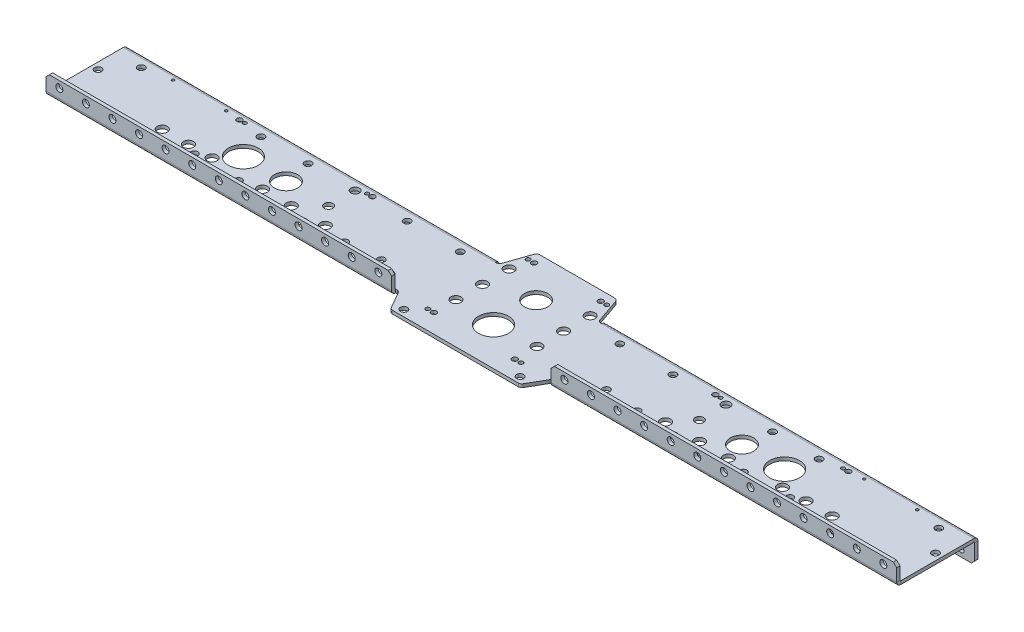
from build123d import *

# Parameters (mm, degrees)
SKETCH1_W                              = 812.8
SKETCH1_H                              = 69.85
BOSS_EXTRUDE1_DEPTH                    = 3.175
SKETCH3_R                              = 14.2875
CUT_EXTRUDE1_DEPTH                     = 816.802024467
EDGE_FLANGE1_DEPTH                     = 812.8
EDGE_FLANGE2_DEPTH                     = 812.8
SKETCH10_R                             = 4.826
LONG_6WD_DEPTH                         = 817.444922817
SKETCH11_R                             = 4.826
SHORT_6WD_DEPTH                        = 817.444922817
SKETCH12_R                             = 3.3528
F_8WD_EGG_DEPTH                        = 817.444922817
SKETCH13_R                             = 3.3528
LOWER_CHURRO_DEPTH                     = 817.444922817
SKETCH14_R                             = 2.667
UPPER_FLANGE_HP_DEPTH                  = 817.729920277
SKETCH16_R                             = 3.3528
LOWER_FLANGE_HP_DEPTH                  = 817.433889486
LPATTERN1_COUNT                        = 32
LPATTERN1_PITCH                        = 25.4
SKETCH17_W                             = 152.4
SKETCH17_H                             = 6.35
CUT_EXTRUDE9_DEPTH                     = 818.031193633
SKETCH18_W                             = 146.05
SKETCH18_H                             = 3.175
BOSS_EXTRUDE2_DEPTH                    = 19.05
SKETCH19_W                             = 101.6
SKETCH19_H                             = 3.937
CUT_EXTRUDE10_DEPTH                    = 818.031193633
SKETCH20_W                             = 95.25
SKETCH20_H                             = 3.175
BOSS_EXTRUDE3_DEPTH                    = 27.432
CUT_EXTRUDE14_DEPTH                    = 819.902667079
SKETCH21_R                             = 11.1125
SKETCH21_R_2                           = 4.7625
SKETCH21_R_3                           = 2.54
SKETCH21_R_4                           = 2.032
TB_MINI_SHAFT_PLATE_DEPTH              = 819.8226487
CUT_EXTRUDE12_DEPTH                    = 819.8226487
SKETCH23_R                             = 3.3528
UPPER_INTERNAL_CHIRRO_HP_DEPTH         = 819.8226487
SKETCH24_R                             = 1.27
CUTTING_GUIDES_DEPTH                   = 819.8226487
SKETCH26_R                             = 3.4036
SONIC_MOUNTING_HOLES_DEPTH             = 819.902667079
SKETCH29_R                             = 2.5527
SKETCH29_R_2                           = 1.7859375
SKETCH29_R_3                           = 14.2875
SKETCH29_R_4                           = 11.1125
SKETCH29_R_5                           = 4.064
TB_MICRO_MOUNTING_DEPTH                = 819.902667079
FILLET1_R                              = 3.175
CHAMFER1_SIZE                          = 3.175
SKETCH30_R                             = 3.3528
BOTTOM_CORNER_SUPPORT_USE_CHURRO_DEPTH = 819.902667079
SKETCH32_R                             = 3.3528
CUT_EXTRUDE15_DEPTH                    = 819.902667079
SKETCH33_R                             = 3.3528
CUT_EXTRUDE16_DEPTH                    = 819.902667079


# Sheet-metal steps are written as plain solids
with BuildPart() as part:
    # Sketch1 → Boss-Extrude1 (new body)
    with BuildSketch(Plane(origin=(0, 0, 0), x_dir=(1, 0, 0), z_dir=(0, 1, 0))):
        with Locations((406.4, 34.925)):
            Rectangle(SKETCH1_W, SKETCH1_H)
    extrude(amount=BOSS_EXTRUDE1_DEPTH)

    # Sketch3 → Cut-Extrude1 (cut, through all)
    with BuildSketch(Plane(origin=(0, 3.175, 0), x_dir=(1, 0, 0), z_dir=(0, 1, 0))):
        with Locations(Location((406.4, 17.272, 0), (0, 0, 270))):
            Circle(SKETCH3_R)
    extrude(amount=-CUT_EXTRUDE1_DEPTH, mode=Mode.SUBTRACT)

    # Edge-Flange1 section (across the edge) → Edge-Flange1 (add)
    with BuildSketch(Plane(origin=(0, 3.175, 0.762), x_dir=(0, 0, -1), z_dir=(1, 0, 0))):
        with BuildLine():
            Line((-3.175, 0.762), (-3.175, 15.875))
            Line((-3.175, 15.875), (0, 15.875))
            Line((0, 15.875), (0, 0.762))
            ThreePointArc((0, 0.762), (0.223184633, 0.223184633), (0.762, 0))
            Line((0.762, 0), (0.762, -3.175))
            ThreePointArc((0.762, -3.175), (-2.021879398, -2.021879398), (-3.175, 0.762))
        make_face()
    extrude(amount=EDGE_FLANGE1_DEPTH)

    # Edge-Flange2 section (across the edge) → Edge-Flange2 (add)
    with BuildSketch(Plane(origin=(0, 0, -70.612), x_dir=(0, 0, 1), z_dir=(1, 0, 0))):
        with BuildLine():
            Line((-3.175, 0.762), (-3.175, 19.05))
            Line((-3.175, 19.05), (0, 19.05))
            Line((0, 19.05), (0, 0.762))
            ThreePointArc((0, 0.762), (0.223184633, 0.223184633), (0.762, 0))
            Line((0.762, 0), (0.762, -3.175))
            ThreePointArc((0.762, -3.175), (-2.021879398, -2.021879398), (-3.175, 0.762))
        make_face()
    extrude(amount=EDGE_FLANGE2_DEPTH)

    # Sketch10 → Long 6wd (cut, through all)
    with BuildSketch(Plane(origin=(0, 3.175, 0), x_dir=(1, 0, 0), z_dir=(0, 1, 0))):
        with Locations(Location((86.339113657, 20.828, 0), (0, 0, 270))):
            Circle(SKETCH10_R)
        with Locations(Location((111.349627997, 20.828, 0), (0, 0, 270))):
            Circle(SKETCH10_R)
        with Locations(Location((133.855797334, 20.828, 0), (0, 0, 270))):
            Circle(SKETCH10_R)
        with Locations(Location((726.460886343, 20.828, 0), (0, 0, 270))):
            Circle(SKETCH10_R)
        with Locations(Location((701.450372003, 20.828, 0), (0, 0, 270))):
            Circle(SKETCH10_R)
        with Locations(Location((678.944202666, 20.828, 0), (0, 0, 270))):
            Circle(SKETCH10_R)
    extrude(amount=-LONG_6WD_DEPTH, mode=Mode.SUBTRACT)

    # Sketch11 → Short 6wd (cut, through all)
    with BuildSketch(Plane(origin=(0, 3.175, 0), x_dir=(1, 0, 0), z_dir=(0, 1, 0))):
        with Locations(Location((183.852302373, 19.05, 0), (0, 0, 270))):
            Circle(SKETCH11_R)
        with Locations(Location((211.361504088, 19.05, 0), (0, 0, 270))):
            Circle(SKETCH11_R)
        with Locations(Location((243.875125248, 19.05, 0), (0, 0, 270))):
            Circle(SKETCH11_R)
        with Locations(Location((568.924874752, 19.05, 0), (0, 0, 270))):
            Circle(SKETCH11_R)
        with Locations(Location((601.438495912, 19.05, 0), (0, 0, 270))):
            Circle(SKETCH11_R)
        with Locations(Location((628.947697627, 19.05, 0), (0, 0, 270))):
            Circle(SKETCH11_R)
    extrude(amount=-SHORT_6WD_DEPTH, mode=Mode.SUBTRACT)

    # Sketch12 → 8wd egg (cut, through all)
    with BuildSketch(Plane(origin=(0, 3.175, 0), x_dir=(1, 0, 0), z_dir=(0, 1, 0))):
        with Locations(Location((298.874532383, 17.547282407, 0), (0, 0, 270))):
            Circle(SKETCH12_R)
        with Locations(Location((513.925467617, 17.547282407, 0), (0, 0, 270))):
            Circle(SKETCH12_R)
    extrude(amount=-F_8WD_EGG_DEPTH, mode=Mode.SUBTRACT)

    # Sketch13 → lower churro (cut, through all)
    with BuildSketch(Plane(origin=(0, 3.175, 0), x_dir=(1, 0, 0), z_dir=(0, 1, 0))):
        with Locations(Location((165.1, 14.732, 0), (0, 0, 270))):
            Circle(SKETCH13_R)
        with Locations(Location((266.7, 14.732, 0), (0, 0, 270))):
            Circle(SKETCH13_R)
        with Locations(Location((546.1, 14.732, 0), (0, 0, 270))):
            Circle(SKETCH13_R)
        with Locations(Location((647.7, 14.732, 0), (0, 0, 270))):
            Circle(SKETCH13_R)
    extrude(amount=-LOWER_CHURRO_DEPTH, mode=Mode.SUBTRACT)

    # Sketch14 → upper flange HP (cut, through all)
    with BuildSketch(Plane(origin=(0, 0, -73.787), x_dir=(-1, 0, 0), z_dir=(0, 0, -1))):
        with Locations(Location((-12.7, -12.7, 0), (0, 0, 90))):
            Circle(SKETCH14_R)
        with Locations(Location((-38.1, -12.7, 0), (0, 0, 90))):
            Circle(SKETCH14_R)
        with Locations(Location((-63.5, -12.7, 0), (0, 0, 90))):
            Circle(SKETCH14_R)
        with Locations(Location((-88.9, -12.7, 0), (0, 0, 90))):
            Circle(SKETCH14_R)
        with Locations(Location((-114.3, -12.7, 0), (0, 0, 90))):
            Circle(SKETCH14_R)
        with Locations(Location((-139.7, -12.7, 0), (0, 0, 90))):
            Circle(SKETCH14_R)
        with Locations(Location((-165.1, -12.7, 0), (0, 0, 90))):
            Circle(SKETCH14_R)
        with Locations(Location((-190.5, -12.7, 0), (0, 0, 90))):
            Circle(SKETCH14_R)
        with Locations(Location((-215.9, -12.7, 0), (0, 0, 90))):
            Circle(SKETCH14_R)
        with Locations(Location((-241.3, -12.7, 0), (0, 0, 90))):
            Circle(SKETCH14_R)
        with Locations(Location((-266.7, -12.7, 0), (0, 0, 90))):
            Circle(SKETCH14_R)
        with Locations(Location((-292.1, -12.7, 0), (0, 0, 90))):
            Circle(SKETCH14_R)
        with Locations(Location((-317.5, -12.7, 0), (0, 0, 90))):
            Circle(SKETCH14_R)
        with Locations(Location((-342.9, -12.7, 0), (0, 0, 90))):
            Circle(SKETCH14_R)
        with Locations(Location((-368.3, -12.7, 0), (0, 0, 90))):
            Circle(SKETCH14_R)
        with Locations(Location((-393.7, -12.7, 0), (0, 0, 90))):
            Circle(SKETCH14_R)
        with Locations(Location((-419.1, -12.7, 0), (0, 0, 90))):
            Circle(SKETCH14_R)
        with Locations(Location((-444.5, -12.7, 0), (0, 0, 90))):
            Circle(SKETCH14_R)
        with Locations(Location((-469.9, -12.7, 0), (0, 0, 90))):
            Circle(SKETCH14_R)
        with Locations(Location((-495.3, -12.7, 0), (0, 0, 90))):
            Circle(SKETCH14_R)
        with Locations(Location((-520.7, -12.7, 0), (0, 0, 90))):
            Circle(SKETCH14_R)
        with Locations(Location((-546.1, -12.7, 0), (0, 0, 90))):
            Circle(SKETCH14_R)
        with Locations(Location((-571.5, -12.7, 0), (0, 0, 90))):
            Circle(SKETCH14_R)
        with Locations(Location((-596.9, -12.7, 0), (0, 0, 90))):
            Circle(SKETCH14_R)
        with Locations(Location((-622.3, -12.7, 0), (0, 0, 90))):
            Circle(SKETCH14_R)
        with Locations(Location((-647.7, -12.7, 0), (0, 0, 90))):
            Circle(SKETCH14_R)
        with Locations(Location((-673.1, -12.7, 0), (0, 0, 90))):
            Circle(SKETCH14_R)
        with Locations(Location((-698.5, -12.7, 0), (0, 0, 90))):
            Circle(SKETCH14_R)
        with Locations(Location((-723.9, -12.7, 0), (0, 0, 90))):
            Circle(SKETCH14_R)
        with Locations(Location((-749.3, -12.7, 0), (0, 0, 90))):
            Circle(SKETCH14_R)
        with Locations(Location((-774.7, -12.7, 0), (0, 0, 90))):
            Circle(SKETCH14_R)
        with Locations(Location((-800.1, -12.7, 0), (0, 0, 90))):
            Circle(SKETCH14_R)
    extrude(amount=-UPPER_FLANGE_HP_DEPTH, mode=Mode.SUBTRACT)

    # Sketch16 → Lower flange HP (cut, through all)
    with BuildSketch(Plane(origin=(0, 0, 0.762), x_dir=(-1, 0, 0), z_dir=(0, 0, -1))):
        with Locations(Location((-12.7, 12.7, 0), (0, 0, 90))):
            Circle(SKETCH16_R)
    lower_flange_hp = extrude(amount=-LOWER_FLANGE_HP_DEPTH, mode=Mode.SUBTRACT)

    # LPattern1: Lower flange HP ×32
    with Locations(*[(i * LPATTERN1_PITCH, 0, 0) for i in range(1, LPATTERN1_COUNT)]):
        add(lower_flange_hp, mode=Mode.SUBTRACT)

    # Sketch17 → Cut-Extrude9 (cut, through all)
    with BuildSketch(Plane(origin=(0, 19.05, 0), x_dir=(1, 0, 0), z_dir=(0, 1, 0))):
        with Locations((406.4, -3.175)):
            Rectangle(SKETCH17_W, SKETCH17_H)
    extrude(amount=-CUT_EXTRUDE9_DEPTH, mode=Mode.SUBTRACT)

    # Sketch18 → Boss-Extrude2 (add)
    with BuildSketch(Plane.XY):
        with Locations((406.4, 1.5875)):
            Rectangle(SKETCH18_W, SKETCH18_H)
    extrude(amount=BOSS_EXTRUDE2_DEPTH)

    # Sketch19 → Cut-Extrude10 (cut, through all)
    with BuildSketch(Plane.XZ.offset(19.05)):
        with Locations((406.4, -71.8185)):
            Rectangle(SKETCH19_W, SKETCH19_H)
    extrude(amount=-CUT_EXTRUDE10_DEPTH, mode=Mode.SUBTRACT)

    # Sketch20 → Boss-Extrude3 (add)
    with BuildSketch(Plane(origin=(0, 0, -69.85), x_dir=(-1, 0, 0), z_dir=(0, 0, -1))):
        with Locations((-406.4, 1.5875)):
            Rectangle(SKETCH20_W, SKETCH20_H)
    extrude(amount=BOSS_EXTRUDE3_DEPTH)

    # Sketch27 → Cut-Extrude14 (cut, through all)
    with BuildSketch(Plane(origin=(0, 3.175, 0), x_dir=(1, 0, 0), z_dir=(0, 1, 0))):
        Polygon((333.375, 0), (344.373522628, -19.05), (333.375, -19.05), align=None)
        Polygon((479.425, 0), (479.425, -19.05), (468.426477372, -19.05), align=None)
    extrude(amount=-CUT_EXTRUDE14_DEPTH, mode=Mode.SUBTRACT)

    # Sketch21 → TB Mini Shaft plate (cut, through all)
    with BuildSketch(Plane.XZ):
        with Locations(Location((406.4, -57.9628, 0), (0, 0, 270))):
            Circle(SKETCH21_R)
        with Locations(Location((445.12429721, -45.466, 0), (0, 0, 270))):
            Circle(SKETCH21_R_2)
        with Locations(Location((367.67570279, -45.466, 0), (0, 0, 270))):
            Circle(SKETCH21_R_2)
        with Locations(Location((445.12429721, -70.866, 0), (0, 0, 270))):
            Circle(SKETCH21_R_2)
        with Locations(Location((445.12429721, -20.066, 0), (0, 0, 270))):
            Circle(SKETCH21_R_2)
        with Locations(Location((367.67570279, -20.066, 0), (0, 0, 270))):
            Circle(SKETCH21_R_2)
        with Locations(Location((367.67570279, -70.866, 0), (0, 0, 270))):
            Circle(SKETCH21_R_2)
        with Locations(Location((438.15, -87.85352, 0), (0, 0, 270))):
            Circle(SKETCH21_R_3)
        with Locations(Location((374.65, -87.85352, 0), (0, 0, 270))):
            Circle(SKETCH21_R_3)
        with Locations(Location((443.992, -87.85352, 0), (0, 0, 270))):
            Circle(SKETCH21_R_4)
        with Locations(Location((368.808, -87.85352, 0), (0, 0, 270))):
            Circle(SKETCH21_R_4)
        with Locations(Location((445.0461, 1.03886, 0), (0, 0, 270))):
            Circle(SKETCH21_R_3)
        with Locations(Location((367.7539, 1.03886, 0), (0, 0, 270))):
            Circle(SKETCH21_R_3)
        with Locations(Location((361.9119, 1.03886, 0), (0, 0, 270))):
            Circle(SKETCH21_R_4)
        with Locations(Location((450.8881, 1.03886, 0), (0, 0, 270))):
            Circle(SKETCH21_R_4)
    extrude(amount=-TB_MINI_SHAFT_PLATE_DEPTH, mode=Mode.SUBTRACT)

    # Sketch22 → Cut-Extrude12 (cut, through all)
    with BuildSketch(Plane.XZ):
        Polygon((454.025, -69.85), (444.579404912, -97.282), (454.025, -97.282), align=None)
        Polygon((358.775, -69.85), (368.220595088, -97.282), (358.775, -97.282), align=None)
    extrude(amount=-CUT_EXTRUDE12_DEPTH, mode=Mode.SUBTRACT)

    # Sketch23 → Upper internal chirro HP (cut, through all)
    with BuildSketch(Plane.XZ):
        with Locations(Location((330.2, -61.722, 0), (0, 0, 270))):
            Circle(SKETCH23_R)
        with Locations(Location((279.4, -61.722, 0), (0, 0, 270))):
            Circle(SKETCH23_R)
        with Locations(Location((139.7, -61.722, 0), (0, 0, 270))):
            Circle(SKETCH23_R)
        with Locations(Location((25.4, -61.722, 0), (0, 0, 270))):
            Circle(SKETCH23_R)
        with Locations(Location((482.6, -61.722, 0), (0, 0, 270))):
            Circle(SKETCH23_R)
        with Locations(Location((533.4, -61.722, 0), (0, 0, 270))):
            Circle(SKETCH23_R)
        with Locations(Location((673.1, -61.722, 0), (0, 0, 270))):
            Circle(SKETCH23_R)
        with Locations(Location((787.4, -61.722, 0), (0, 0, 270))):
            Circle(SKETCH23_R)
        with Locations(Location((6.35, -39.497, 0), (0, 0, 270))):
            Circle(SKETCH23_R)
        with Locations(Location((806.45, -39.497, 0), (0, 0, 270))):
            Circle(SKETCH23_R)
    extrude(amount=-UPPER_INTERNAL_CHIRRO_HP_DEPTH, mode=Mode.SUBTRACT)

    # Sketch24 → Cutting guides (cut, through all)
    with BuildSketch(Plane.XZ):
        with Locations(Location((101.6, -3.175, 0), (0, 0, 270))):
            Circle(SKETCH24_R)
        with Locations(Location((101.6, -66.675, 0), (0, 0, 270))):
            Circle(SKETCH24_R)
        with Locations(Location((50.8, -66.675, 0), (0, 0, 270))):
            Circle(SKETCH24_R)
        with Locations(Location((50.8, -3.175, 0), (0, 0, 270))):
            Circle(SKETCH24_R)
        with Locations(Location((762, -66.675, 0), (0, 0, 270))):
            Circle(SKETCH24_R)
        with Locations(Location((762, -3.175, 0), (0, 0, 270))):
            Circle(SKETCH24_R)
        with Locations(Location((711.2, -3.175, 0), (0, 0, 270))):
            Circle(SKETCH24_R)
        with Locations(Location((711.2, -66.675, 0), (0, 0, 270))):
            Circle(SKETCH24_R)
    extrude(amount=-CUTTING_GUIDES_DEPTH, mode=Mode.SUBTRACT)

    # Sketch26 → Sonic mounting holes (cut, through all)
    with BuildSketch(Plane(origin=(0, 3.175, 0), x_dir=(1, 0, 0), z_dir=(0, 1, 0))):
        with Locations(Location((350.8375, -12.8905, 0), (0, 0, 270))):
            Circle(SKETCH26_R)
        with Locations(Location((461.9625, -12.8905, 0), (0, 0, 270))):
            Circle(SKETCH26_R)
    extrude(amount=-SONIC_MOUNTING_HOLES_DEPTH, mode=Mode.SUBTRACT)

    # Sketch29 → TB Micro Mounting (cut, through all)
    with BuildSketch(Plane(origin=(0, 3.175, 0), x_dir=(1, 0, 0), z_dir=(0, 1, 0))):
        with Locations(Location((115.520362832, 65.405, 0), (0, 0, 270))):
            Circle(SKETCH29_R)
        with Locations(Location((120.600362832, 65.405, 0), (0, 0, 270))):
            Circle(SKETCH29_R_2)
        with Locations(Location((147.829162832, 36.83, 0), (0, 0, 270))):
            Circle(SKETCH29_R_3)
        with Locations(Location((115.520362832, 8.255, 0), (0, 0, 270))):
            Circle(SKETCH29_R)
        with Locations(Location((120.600362832, 8.255, 0), (0, 0, 270))):
            Circle(SKETCH29_R_2)
        with Locations(Location((188.545362832, 36.83, 0), (0, 0, 270))):
            Circle(SKETCH29_R_4)
        with Locations(Location((229.261562832, 36.83, 0), (0, 0, 270))):
            Circle(SKETCH29_R_5)
        with Locations(Location((229.261562832, 62.23, 0), (0, 0, 270))):
            Circle(SKETCH29_R_5)
        with Locations(Location((229.261562832, 11.43, 0), (0, 0, 270))):
            Circle(SKETCH29_R_5)
        with Locations(Location((237.440362832, 8.255, 0), (0, 0, 270))):
            Circle(SKETCH29_R_2)
        with Locations(Location((242.520362832, 8.255, 0), (0, 0, 270))):
            Circle(SKETCH29_R)
        with Locations(Location((237.440362832, 65.405, 0), (0, 0, 270))):
            Circle(SKETCH29_R_2)
        with Locations(Location((242.520362832, 65.405, 0), (0, 0, 270))):
            Circle(SKETCH29_R)
        with Locations(Location((570.279637168, 65.405, 0), (0, 0, 270))):
            Circle(SKETCH29_R)
        with Locations(Location((575.359637168, 65.405, 0), (0, 0, 270))):
            Circle(SKETCH29_R_2)
        with Locations(Location((583.538437168, 62.23, 0), (0, 0, 270))):
            Circle(SKETCH29_R_5)
        with Locations(Location((583.538437168, 36.83, 0), (0, 0, 270))):
            Circle(SKETCH29_R_5)
        with Locations(Location((624.254637168, 36.83, 0), (0, 0, 270))):
            Circle(SKETCH29_R_4)
        with Locations(Location((570.279637168, 8.255, 0), (0, 0, 270))):
            Circle(SKETCH29_R)
        with Locations(Location((575.359637168, 8.255, 0), (0, 0, 270))):
            Circle(SKETCH29_R_2)
        with Locations(Location((583.538437168, 11.43, 0), (0, 0, 270))):
            Circle(SKETCH29_R_5)
        with Locations(Location((664.970837168, 36.83, 0), (0, 0, 270))):
            Circle(SKETCH29_R_3)
        with Locations(Location((692.199637168, 65.405, 0), (0, 0, 270))):
            Circle(SKETCH29_R_2)
        with Locations(Location((697.279637168, 65.405, 0), (0, 0, 270))):
            Circle(SKETCH29_R)
        with Locations(Location((692.199637168, 8.255, 0), (0, 0, 270))):
            Circle(SKETCH29_R_2)
        with Locations(Location((697.279637168, 8.255, 0), (0, 0, 270))):
            Circle(SKETCH29_R)
    extrude(amount=-TB_MICRO_MOUNTING_DEPTH, mode=Mode.SUBTRACT)

    # Fillet1
    fillet1_edges = [part.edges().sort_by_distance(p)[0] for p in [
        (333.375, 1.5875, 0),
        (479.425, 1.5875, 0),
        (454.025, 1.5875, -69.85),
        (358.775, 1.5875, -69.85),
        (468.426477372, 1.5875, 19.05),
        (344.373522628, 1.5875, 19.05),
        (368.220595088, 1.5875, -97.282),
        (444.579404912, 1.5875, -97.282),
    ]]
    fillet(fillet1_edges, radius=FILLET1_R)

    # Chamfer1
    chamfer1_edges = [part.edges().sort_by_distance(p)[0] for p in [
        (0, 19.05, 2.3495),
        (812.8, 19.05, 2.3495),
        (482.6, 19.05, 2.3495),
        (330.2, 19.05, 2.3495),
        (0, -19.05, -72.1995),
        (812.8, -19.05, -72.1995),
        (355.6, -19.05, -72.1995),
        (457.2, -19.05, -72.1995),
    ]]
    chamfer(chamfer1_edges, length=CHAMFER1_SIZE)

    # Sketch30 → Bottom Corner Support (use churro) (cut, through all)
    with BuildSketch(Plane(origin=(0, 3.175, 0), x_dir=(1, 0, 0), z_dir=(0, 1, 0))):
        with Locations(Location((72.898, 9.525, 0), (0, 0, 270))):
            Circle(SKETCH30_R)
        with Locations(Location((121.92, 15.875, 0), (0, 0, 270))):
            Circle(SKETCH30_R)
        with Locations(Location((739.902, 9.525, 0), (0, 0, 90))):
            Circle(SKETCH30_R)
        with Locations(Location((690.88, 15.875, 0), (0, 0, 90))):
            Circle(SKETCH30_R)
    extrude(amount=-BOTTOM_CORNER_SUPPORT_USE_CHURRO_DEPTH, mode=Mode.SUBTRACT)

    # Sketch32 → Cut-Extrude15 (cut, through all)
    with BuildSketch(Plane(origin=(0, 3.175, 0), x_dir=(1, 0, 0), z_dir=(0, 1, 0))):
        with Locations(Location((184.480781416, 61.976, 0), (0, 0, 270))):
            Circle(SKETCH32_R)
        with Locations(Location((628.319218584, 61.976, 0), (0, 0, 90))):
            Circle(SKETCH32_R)
    extrude(amount=-CUT_EXTRUDE15_DEPTH, mode=Mode.SUBTRACT)

    # Sketch33 → Cut-Extrude16 (cut, through all)
    with BuildSketch(Plane(origin=(0, 3.175, 0), x_dir=(1, 0, 0), z_dir=(0, 1, 0))):
        with Locations(Location((200.025, 10.287, 0), (0, 0, 270))):
            Circle(SKETCH33_R)
        with Locations(Location((314.325, 10.287, 0), (0, 0, 270))):
            Circle(SKETCH33_R)
        with Locations(Location((498.475, 10.287, 0), (0, 0, 90))):
            Circle(SKETCH33_R)
        with Locations(Location((612.775, 10.287, 0), (0, 0, 90))):
            Circle(SKETCH33_R)
    extrude(amount=-CUT_EXTRUDE16_DEPTH, mode=Mode.SUBTRACT)


solid = part.part
